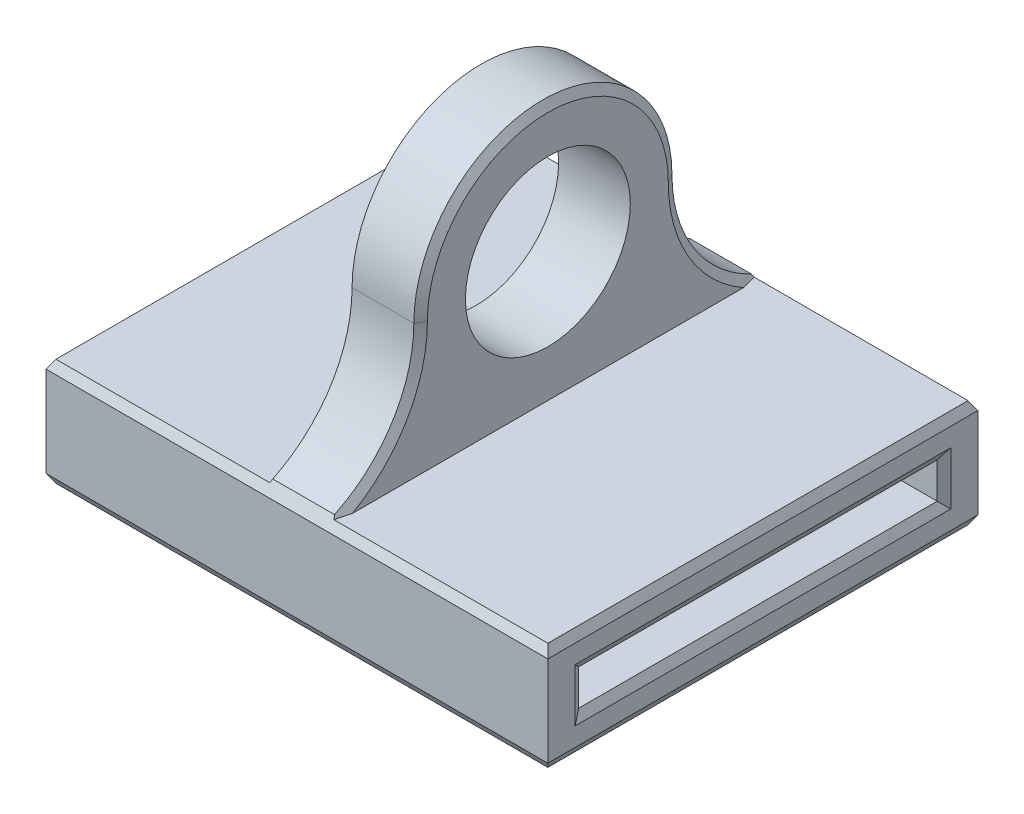
from build123d import *
from OCP.BRepFilletAPI import BRepFilletAPI_MakeChamfer

# Parameters (mm, degrees)
SKETCH_1_W               = 70
SKETCH_1_H               = 60
EXTRUDE_1_DEPTH          = 15
SKETCH_2_R               = 11.5
EXTRUDE_3_DEPTH          = 5
CUT_EXTRUDE_1_DEPTH      = 69.745908969
CUT_EXTRUDE_1_DEPTH_BACK = 69.745908969
SKETCH_3_W               = 50
SKETCH_3_H               = 5
CHAMFER_1_SIZE           = 1.2
CHAMFER_1_SIZE2          = 0.692820323
CHAMFER_2_SIZE           = 1.2
CHAMFER_2_SIZE_2         = 0.692820323
CHAMFER_3_SIZE           = 1.2
CHAMFER_3_SIZE_2         = 0.692820323
CHAMFER_4_SIZE           = 1.2
CHAMFER_4_SIZE2          = 0.692820323


with BuildPart() as part:
    # 스케치1 → 보스-돌출1 (new body)
    with BuildSketch(Plane(origin=(0, 0, 0), x_dir=(1, 0, 0), z_dir=(0, 1, 0))):
        Rectangle(SKETCH_1_W, SKETCH_1_H)
    extrude(amount=EXTRUDE_1_DEPTH)

    # 스케치2 → 보스-돌출3 (add, symmetric)
    with BuildSketch(Plane(origin=(0, 0, 0), x_dir=(0, 0, -1), z_dir=(1, 0, 0))):
        with BuildLine():
            ThreePointArc((30, 15), (21.27501926, 22.183346174), (18, 33))
            ThreePointArc((18, 33), (0, 51), (-18, 33))
            ThreePointArc((-18, 33), (-21.27501926, 22.183346174), (-30, 15))
            Line((-30, 15), (30, 15))
        make_face()
        with Locations((0, 33)):
            Circle(SKETCH_2_R, mode=Mode.SUBTRACT)
    extrude(amount=EXTRUDE_3_DEPTH, both=True)

    # 스케치3 → 컷-돌출1 (cut, two sides: drawn at the far end of the back side and taken through both)
    with BuildSketch(Plane(origin=(0, 0, 0), x_dir=(0, 0, -1), z_dir=(1, 0, 0)).offset(-CUT_EXTRUDE_1_DEPTH_BACK)):
        with Locations((0, 7.5)):
            Rectangle(SKETCH_3_W, SKETCH_3_H)
    extrude(amount=CUT_EXTRUDE_1_DEPTH + CUT_EXTRUDE_1_DEPTH_BACK, mode=Mode.SUBTRACT)

    # 모따기1: one chamfer whose edges measure the first distance from different faces: ONE call of the kernel's chamfer builder (chamfer() names one face for all edges)
    chamfer_1_edges_1 = [part.edges().sort_by_distance(p)[0] for p in [
        (0, 0, 30),
    ]]
    chamfer_1_side_1 = [part.faces().sort_by_distance(p)[0] for p in [
        (0, 7.5, 30),
    ]]
    chamfer_1_edges_2 = [part.edges().sort_by_distance(p)[0] for p in [
        (-35, 0, 0),
    ]]
    chamfer_1_side_2 = [part.faces().sort_by_distance(p)[0] for p in [
        (-35, 7.5, -29.381534156),
    ]]
    chamfer_1_edges_3 = [part.edges().sort_by_distance(p)[0] for p in [
        (0, 0, -30),
    ]]
    chamfer_1_side_3 = [part.faces().sort_by_distance(p)[0] for p in [
        (0, 7.5, -30),
    ]]
    chamfer_1_edges_4 = [part.edges().sort_by_distance(p)[0] for p in [
        (35, 0, 0),
    ]]
    chamfer_1_side_4 = [part.faces().sort_by_distance(p)[0] for p in [
        (35, 7.5, 29.381534156),
    ]]
    chamfer_1 = BRepFilletAPI_MakeChamfer(part.part.solid().wrapped)
    for e in chamfer_1_edges_1:
        chamfer_1.Add(CHAMFER_1_SIZE, CHAMFER_1_SIZE2, e.wrapped, chamfer_1_side_1[0].wrapped)  # the first distance lies on this face
    for e in chamfer_1_edges_2:
        chamfer_1.Add(CHAMFER_1_SIZE, CHAMFER_1_SIZE2, e.wrapped, chamfer_1_side_2[0].wrapped)  # the first distance lies on this face
    for e in chamfer_1_edges_3:
        chamfer_1.Add(CHAMFER_1_SIZE, CHAMFER_1_SIZE2, e.wrapped, chamfer_1_side_3[0].wrapped)  # the first distance lies on this face
    for e in chamfer_1_edges_4:
        chamfer_1.Add(CHAMFER_1_SIZE, CHAMFER_1_SIZE2, e.wrapped, chamfer_1_side_4[0].wrapped)  # the first distance lies on this face
    add(Compound.cast(chamfer_1.Shape()), mode=Mode.REPLACE)

    # 모따기2
    # the kernel refuses this chamfer: 1.2, 0.98830445, 0.692820323 mm, written as the material it takes off along each edge
    with BuildSketch(Plane(origin=(-35, 15, -33.104502906), x_dir=(0, -1, 0), z_dir=(0, 0, 1)), Plane(origin=(35, 15, 33.104502906), x_dir=(0, -1, 0), z_dir=(0, 0, -1))) as chamfer_2_piece_1:
        Polygon((CHAMFER_2_SIZE, 0), (0, CHAMFER_2_SIZE_2), (0, 0), align=None)
    extrude(amount=66.209005811, mode=Mode.SUBTRACT)
    with BuildSketch(Plane(origin=(-5, 15, -30), x_dir=(0, 0, 1), z_dir=(-1, 0, 0)), Plane(origin=(38.104502906, 15, -30), x_dir=(0, 0, 1), z_dir=(-1, 0, 0))) as chamfer_2_piece_2:
        Polygon((CHAMFER_2_SIZE_2, 0), (0, -CHAMFER_2_SIZE), (0, 0), align=None)
    extrude(amount=33.104502906, mode=Mode.SUBTRACT)
    with BuildSketch(Plane(origin=(5, 15, 30), x_dir=(0, -1, 0), z_dir=(1, 0, 0)), Plane(origin=(-38.104502906, 15, 30), x_dir=(0, -1, 0), z_dir=(1, 0, 0))) as chamfer_2_piece_3:
        Polygon((CHAMFER_2_SIZE, 0), (0, CHAMFER_2_SIZE_2), (0, 0), align=None)
    extrude(amount=33.104502906, mode=Mode.SUBTRACT)
    with BuildSketch(Plane(origin=(-5, 15, -30), x_dir=(0, -1, 0), z_dir=(1, 0, 0)), Plane(origin=(5, 15, 30), x_dir=(0, -1, 0), z_dir=(-1, 0, 0))) as chamfer_2_piece_4:
        with BuildLine():
            Line((CHAMFER_2_SIZE, 0), (-0.41845847, -0.934417434))
            ThreePointArc((-0.41845847, -0.934417434), (-0.211061153, -0.487718993), (0, 0))
            Line((0, 0), (CHAMFER_2_SIZE, 0))
        make_face()
    extrude(amount=10, mode=Mode.SUBTRACT)

    # 모따기3
    # the kernel refuses this chamfer: 1.2, 0.692820323 mm, written as the material it takes off along each edge
    with BuildSketch(Plane(origin=(5, 33, -37.5), x_dir=(0, -0.958795780822353, 0.2840961996881595), z_dir=(0, -0.2840961996881595, -0.958795780822353))) as chamfer_3_piece_1_section:
        Polygon((19.5 + CHAMFER_3_SIZE, 0), (19.5, CHAMFER_3_SIZE_2), (19.5, 0), align=None)
    chamfer_3_piece_1 = revolve(axis=Axis((5, 33, -37.5), (-1, 0, 0)), revolution_arc=73.495168323, mode=Mode.PRIVATE)
    chamfer_3_piece_1 = split(chamfer_3_piece_1, bisect_by=Plane(origin=(5, 15, -37.5), z_dir=(0, 1, 0)), keep=Keep.TOP, mode=Mode.PRIVATE)
    add(chamfer_3_piece_1, mode=Mode.SUBTRACT)
    with BuildSketch(Plane(origin=(5, 33, 37.5), x_dir=(0, 0, -1), z_dir=(0, 1, 0))) as chamfer_3_piece_2_section:
        Polygon((19.5, CHAMFER_3_SIZE_2), (19.5 + CHAMFER_3_SIZE, 0), (19.5, 0), align=None)
    chamfer_3_piece_2 = revolve(axis=Axis((5, 33, 37.5), (-1, 0, 0)), revolution_arc=73.495168323, mode=Mode.PRIVATE)
    chamfer_3_piece_2 = split(chamfer_3_piece_2, bisect_by=Plane(origin=(5, 15, 37.5), z_dir=(0, 1, 0)), keep=Keep.TOP, mode=Mode.PRIVATE)
    add(chamfer_3_piece_2, mode=Mode.SUBTRACT)
    with BuildSketch(Plane(origin=(5, 33, 0), x_dir=(0, 0, -1), z_dir=(0, -1, 0))) as chamfer_3_piece_3:
        Polygon((18 - CHAMFER_3_SIZE, 0), (18, -CHAMFER_3_SIZE_2), (18, 0), align=None)
    revolve(axis=Axis((5, 33, 0), (1, 0, 0)), revolution_arc=180, mode=Mode.SUBTRACT)
    with BuildSketch(Plane(origin=(-5, 33, -37.5), x_dir=(0, -0.958795780822353, 0.2840961996881595), z_dir=(0, -0.2840961996881595, -0.958795780822353))) as chamfer_3_piece_4_section:
        Polygon((19.5 + CHAMFER_3_SIZE, 0), (19.5, -CHAMFER_3_SIZE_2), (19.5, 0), align=None)
    chamfer_3_piece_4 = revolve(axis=Axis((-5, 33, -37.5), (-1, 0, 0)), revolution_arc=73.495168323, mode=Mode.PRIVATE)
    chamfer_3_piece_4 = split(chamfer_3_piece_4, bisect_by=Plane(origin=(-5, 15, -37.5), z_dir=(0, 1, 0)), keep=Keep.TOP, mode=Mode.PRIVATE)
    add(chamfer_3_piece_4, mode=Mode.SUBTRACT)
    with BuildSketch(Plane(origin=(-5, 33, 0), x_dir=(0, 0, -1), z_dir=(0, -1, 0))) as chamfer_3_piece_5:
        Polygon((18 - CHAMFER_3_SIZE, 0), (18, CHAMFER_3_SIZE_2), (18, 0), align=None)
    revolve(axis=Axis((-5, 33, 0), (1, 0, 0)), revolution_arc=180, mode=Mode.SUBTRACT)
    with BuildSketch(Plane(origin=(-5, 33, 37.5), x_dir=(0, 0, -1), z_dir=(0, 1, 0))) as chamfer_3_piece_6_section:
        Polygon((19.5, -CHAMFER_3_SIZE_2), (19.5 + CHAMFER_3_SIZE, 0), (19.5, 0), align=None)
    chamfer_3_piece_6 = revolve(axis=Axis((-5, 33, 37.5), (-1, 0, 0)), revolution_arc=73.495168323, mode=Mode.PRIVATE)
    chamfer_3_piece_6 = split(chamfer_3_piece_6, bisect_by=Plane(origin=(-5, 15, 37.5), z_dir=(0, 1, 0)), keep=Keep.TOP, mode=Mode.PRIVATE)
    add(chamfer_3_piece_6, mode=Mode.SUBTRACT)

    # 모따기4: one chamfer whose edges measure the first distance from different faces: ONE call of the kernel's chamfer builder (chamfer() names one face for all edges)
    chamfer_4_edges_1 = [part.edges().sort_by_distance(p)[0] for p in [
        (-35, 7.5, 25),
    ]]
    chamfer_4_side_1 = [part.faces().sort_by_distance(p)[0] for p in [
        (0, 7.5, 25),
    ]]
    chamfer_4_edges_2 = [part.edges().sort_by_distance(p)[0] for p in [
        (-35, 10, 0),
    ]]
    chamfer_4_side_2 = [part.faces().sort_by_distance(p)[0] for p in [
        (0, 10, 0),
    ]]
    chamfer_4_edges_3 = [part.edges().sort_by_distance(p)[0] for p in [
        (-35, 7.5, -25),
    ]]
    chamfer_4_side_3 = [part.faces().sort_by_distance(p)[0] for p in [
        (0, 7.5, -25),
    ]]
    chamfer_4_edges_4 = [part.edges().sort_by_distance(p)[0] for p in [
        (-35, 5, 0),
    ]]
    chamfer_4_side_4 = [part.faces().sort_by_distance(p)[0] for p in [
        (0, 5, 0),
    ]]
    chamfer_4_edges_5 = [part.edges().sort_by_distance(p)[0] for p in [
        (35, 7.5, 25),
        (35, 5, 0),
        (35, 7.5, -25),
        (35, 10, 0),
    ]]
    chamfer_4_side_5 = [part.faces().sort_by_distance(p)[0] for p in [
        (35, 1.813087269, 0),
    ]]
    chamfer_4 = BRepFilletAPI_MakeChamfer(part.part.solid().wrapped)
    for e in chamfer_4_edges_1:
        chamfer_4.Add(CHAMFER_4_SIZE, CHAMFER_4_SIZE2, e.wrapped, chamfer_4_side_1[0].wrapped)  # the first distance lies on this face
    for e in chamfer_4_edges_2:
        chamfer_4.Add(CHAMFER_4_SIZE, CHAMFER_4_SIZE2, e.wrapped, chamfer_4_side_2[0].wrapped)  # the first distance lies on this face
    for e in chamfer_4_edges_3:
        chamfer_4.Add(CHAMFER_4_SIZE, CHAMFER_4_SIZE2, e.wrapped, chamfer_4_side_3[0].wrapped)  # the first distance lies on this face
    for e in chamfer_4_edges_4:
        chamfer_4.Add(CHAMFER_4_SIZE, CHAMFER_4_SIZE2, e.wrapped, chamfer_4_side_4[0].wrapped)  # the first distance lies on this face
    for e in chamfer_4_edges_5:
        chamfer_4.Add(CHAMFER_4_SIZE, CHAMFER_4_SIZE2, e.wrapped, chamfer_4_side_5[0].wrapped)  # the first distance lies on this face
    add(Compound.cast(chamfer_4.Shape()), mode=Mode.REPLACE)


solid = part.part
